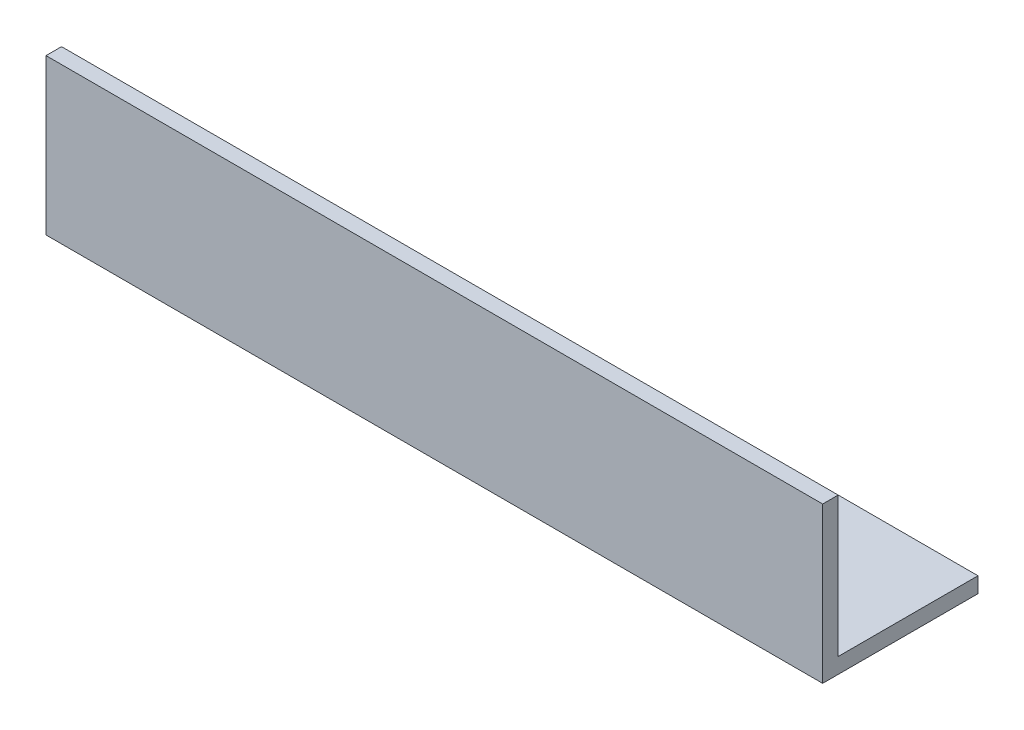
from build123d import *

# Parameters (mm, degrees)
EXTRUDE_1_DEPTH = 150


with BuildPart() as part:
    # Эскиз1 → Вытянуть-Тонкостенный1 (new body)
    with BuildSketch(Plane(origin=(0, 0, 0), x_dir=(0, 0, -1), z_dir=(1, 0, 0))):
        Polygon((30, 0), (0, 0), (0, 30), (3, 30), (3, 3), (30, 3), align=None)
    extrude(amount=EXTRUDE_1_DEPTH)


solid = part.part
